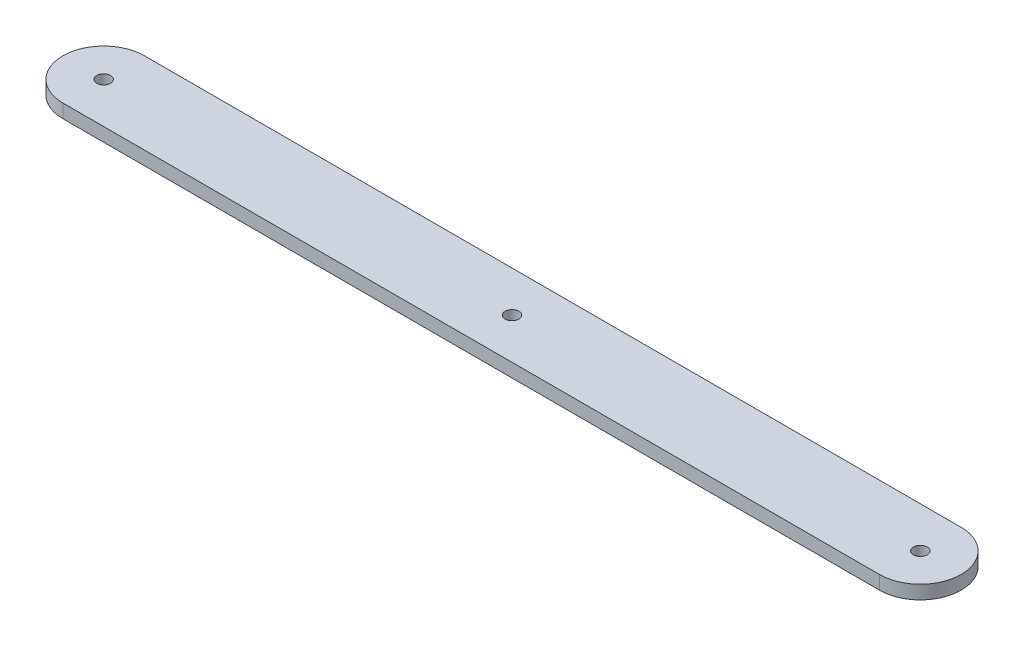
from build123d import *

# Parameters (mm, degrees)
BOSS_EXTRUDE1_DEPTH  = 3.175
M3_CLEARANCE_HOLE1_D = 3.2


with BuildPart() as part:
    # Sketch1 → Boss-Extrude1 (new body)
    with BuildSketch(Plane(origin=(0, 0, 0), x_dir=(1, 0, 0), z_dir=(0, 1, 0))):
        with BuildLine():
            Line((-95.25, 9.525), (95.25, 9.525))
            ThreePointArc((95.25, 9.525), (104.775, 0), (95.25, -9.525))
            Line((95.25, -9.525), (-95.25, -9.525))
            ThreePointArc((-95.25, -9.525), (-104.775, 0), (-95.25, 9.525))
        make_face()
    extrude(amount=BOSS_EXTRUDE1_DEPTH)

    # M3 Clearance Hole1 (through all)
    with Locations(Plane(origin=(0, 3.175, 0), x_dir=(1, 0, 0), z_dir=(0, 1, 0))):
        with Locations((-95.25, 0), (0, 0), (95.25, 0)):
            Hole(M3_CLEARANCE_HOLE1_D / 2)


solid = part.part
